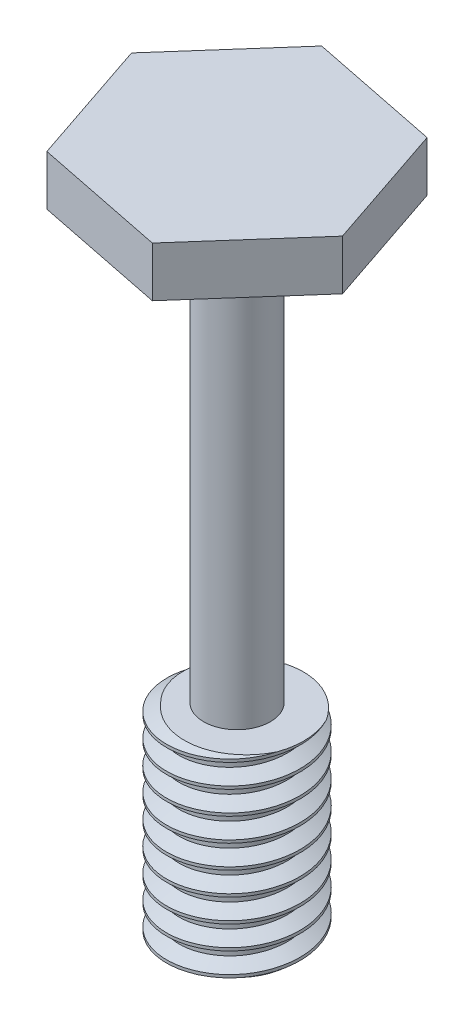
from build123d import *

# Parameters (mm, degrees)
THREAD1_PITCH       = 0.7
CUT_EXTRUDE1_START  = -1.5
SKETCH2_R           = 4
CUT_EXTRUDE1_DEPTH  = 1.5
BOSS_EXTRUDE1_DEPTH = 1.5


with BuildPart() as part:
    # Sketch1 → Revolve1 (revolve)
    with BuildSketch(Plane.XY, mode=Mode.PRIVATE) as revolve1_sk:
        Polygon((0, 20.5), (4, 20.5), (4, 19), (1, 19), (1, 6), (2, 6), (2, 0), (0, 0), align=None)
    revolve(revolve1_sk.sketch.rotate(Axis((0, 9.173319328, 0), (0, -1, 0)), 90), axis=Axis((0, 9.173319328, 0), (0, -1, 0)))

    # Thread1: the profile of Thread Profile1 profile screwed along a right-hand helix of 14.285714 turns, 6 arcs to a turn; built about Z, then put on its axis
    thread1_z = Axis((0, 0, 0), (0, 0, 1))
    thread1_corners = [(2.0003, 0, -0.000173205), (2.0003, 0, 0.612673203), (1.621113887, 0, 0.393749999), (1.621113887, 0, 0.218749999)]
    with BuildLine(mode=Mode.PRIVATE) as thread1_profile:
        Line(thread1_corners[0], thread1_corners[1])
        Line(thread1_corners[1], thread1_corners[2])
        Line(thread1_corners[2], thread1_corners[3])
        Line(thread1_corners[3], thread1_corners[0])
    thread1_cap = Face(thread1_profile.wire())
    thread1_turn_angles = [0, 30, 60, 90, 120, 150, 180, 210, 240, 270, 300, 330, 360]
    thread1_turn_weights = [1, 0.8660254037844387, 1, 0.8660254037844387, 1, 0.8660254037844387, 1, 0.8660254037844387, 1, 0.8660254037844387, 1, 0.8660254037844387, 1]
    thread1_turn_rails = [Edge.make_bspline([Vector(p[0], p[1], 0).rotate(thread1_z, thread1_turn_angles[k]) / thread1_turn_weights[k] + Vector(0, 0, p[2] + THREAD1_PITCH * thread1_turn_angles[k] / 360) for k in range(13)], [0, 0, 0, 1, 1, 2, 2, 3, 3, 4, 4, 5, 5, 6, 6, 6], 2, thread1_turn_weights) for p in thread1_corners]
    thread1_turn_sides = [Face.make_surface_from_curves(thread1_turn_rails[p[0]], thread1_turn_rails[p[1]]) for p in [(0, 1), (1, 2), (2, 3), (3, 0)]]
    thread1_last_angles = [5040, 5070, 5100, 5121.428571429, 5142.857142857]
    thread1_last_weights = [1, 0.8660254037844387, 1, 0.9308737486442035, 1]
    thread1_last_rails = [Edge.make_bspline([Vector(p[0], p[1], 0).rotate(thread1_z, thread1_last_angles[k]) / thread1_last_weights[k] + Vector(0, 0, p[2] + THREAD1_PITCH * thread1_last_angles[k] / 360) for k in range(5)], [0, 0, 0, 1, 1, 2, 2, 2], 2, thread1_last_weights) for p in thread1_corners]
    thread1_last_sides = [Face.make_surface_from_curves(thread1_last_rails[p[0]], thread1_last_rails[p[1]]) for p in [(0, 1), (1, 2), (2, 3), (3, 0)]]
    thread1 = Plane(origin=(0, 7, 0), x_dir=(-1, 0, 0), z_dir=(0, -1, 0)) * Solid(Shell([*[p.moved(Location((0, 0, THREAD1_PITCH * i))) for i in range(14) for p in thread1_turn_sides], *thread1_last_sides, thread1_cap, thread1_cap.rotate(thread1_z, 5142.857142857).moved(Location((0, 0, THREAD1_PITCH * 5142.857142857 / 360)))]))
    add(thread1, mode=Mode.SUBTRACT)

    # Sketch2 → Cut-Extrude1 (cut)
    with BuildSketch(Plane(origin=(0, 20.5, 0), x_dir=(1, 0, 0), z_dir=(0, 1, 0)).offset(CUT_EXTRUDE1_START)):
        Circle(SKETCH2_R)
    extrude(amount=CUT_EXTRUDE1_DEPTH, mode=Mode.SUBTRACT)

    # Sketch3 → Boss-Extrude1 (add)
    with BuildSketch(Plane(origin=(0, 19, 0), x_dir=(1, 0, 0), z_dir=(0, 1, 0))):
        Polygon((-2.67174, -3.032348711), (1.290221017, -3.829969068), (3.961961017, -0.797620357), (2.67174, 3.032348711), (-1.290221017, 3.829969068), (-3.961961017, 0.797620357), align=None)
    extrude(amount=BOSS_EXTRUDE1_DEPTH)


solid = part.part
